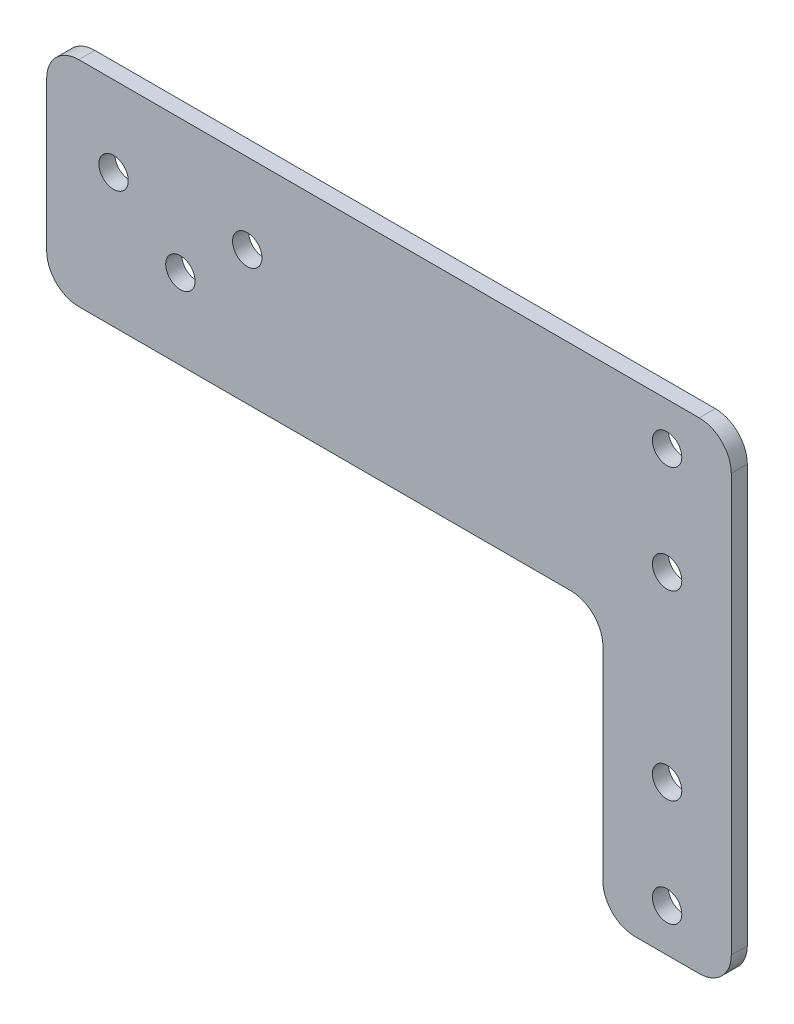
from build123d import *

# Parameters (mm, degrees)
ODGI_CIE_BAZOWE1_DEPTH = 3
OTW_R_POD_RUB_M51_D    = 5.5
ZAOKR_GLENIE1_R        = 6


# Sheet-metal steps are written as plain solids
with BuildPart() as part:
    # Szkic1 → Odgięcie bazowe1 (new body)
    with BuildSketch(Plane.XY):
        Polygon((0, 0), (-104, 0), (-104, 40), (24, 40), (24, -50), (0, -50), align=None)
    extrude(amount=-ODGI_CIE_BAZOWE1_DEPTH)

    # Otwór pod śrubę M51 (through all)
    with Locations(Plane.XY):
        with Locations((12, -42), (12, -22), (12, 12), (12, 32), (-91.5, 25), (-66.5, 25), (-79, 15)):
            Hole(OTW_R_POD_RUB_M51_D / 2)

    # Zaokrąglenie1
    zaokr_glenie1_edges = [part.edges().sort_by_distance(p)[0] for p in [
        (0, 0, -1.5),
        (-104, 0, -1.5),
        (-104, 40, -1.5),
        (24, 40, -1.5),
        (24, -50, -1.5),
        (0, -50, -1.5),
    ]]
    fillet(zaokr_glenie1_edges, radius=ZAOKR_GLENIE1_R)


solid = part.part
